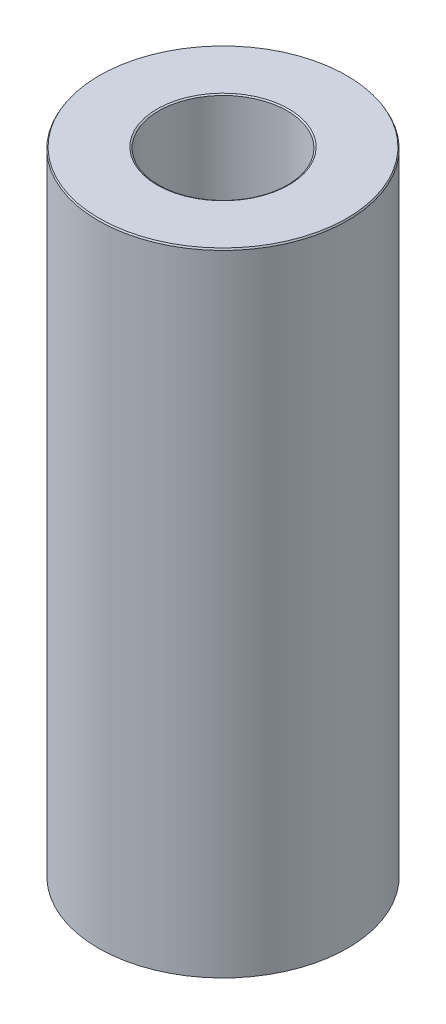
from build123d import *
from OCP.BRepFilletAPI import BRepFilletAPI_MakeChamfer

# Parameters (mm, degrees)
SKETCH1_R           = 35
BOSS_EXTRUDE1_DEPTH = 177.647973818
SKETCH2_R           = 18.075772868
CUT_EXTRUDE1_DEPTH  = 185.414757006
CHAMFER1_SIZE       = 0.430090085
CHAMFER1_SIZE2      = 0.248312626


with BuildPart() as part:
    # Sketch1 → Boss-Extrude1 (new body)
    with BuildSketch(Plane(origin=(0, 0, 0), x_dir=(1, 0, 0), z_dir=(0, 1, 0))):
        Circle(SKETCH1_R)
    extrude(amount=BOSS_EXTRUDE1_DEPTH)

    # Sketch2 → Cut-Extrude1 (cut, through all)
    with BuildSketch(Plane(origin=(0, 0, 0), x_dir=(1, 0, 0), z_dir=(0, 1, 0))):
        Circle(SKETCH2_R)
    extrude(amount=CUT_EXTRUDE1_DEPTH, mode=Mode.SUBTRACT)

    # Chamfer1: one chamfer whose edges measure the first distance from different faces: ONE call of the kernel's chamfer builder (chamfer() names one face for all edges)
    chamfer1_edges_1 = [part.edges().sort_by_distance(p)[0] for p in [
        (-18.075772868, 177.647973818, 0),
    ]]
    chamfer1_side_1 = [part.faces().sort_by_distance(p)[0] for p in [
        (-34.010050506, 177.647973818, 0),
    ]]
    chamfer1_edges_2 = [part.edges().sort_by_distance(p)[0] for p in [
        (-18.075772868, 0, 0),
    ]]
    chamfer1_side_2 = [part.faces().sort_by_distance(p)[0] for p in [
        (-18.075772868, 88.823986909, 0),
    ]]
    chamfer1_edges_3 = [part.edges().sort_by_distance(p)[0] for p in [
        (-35, 0, 0),
    ]]
    chamfer1_side_3 = [part.faces().sort_by_distance(p)[0] for p in [
        (-34.010050506, 0, 0),
    ]]
    chamfer1_edges_4 = [part.edges().sort_by_distance(p)[0] for p in [
        (-35, 177.647973818, 0),
    ]]
    chamfer1_side_4 = [part.faces().sort_by_distance(p)[0] for p in [
        (-35, 88.823986909, 0),
    ]]
    chamfer1 = BRepFilletAPI_MakeChamfer(part.part.solid().wrapped)
    for e in chamfer1_edges_1:
        chamfer1.Add(CHAMFER1_SIZE, CHAMFER1_SIZE2, e.wrapped, chamfer1_side_1[0].wrapped)  # the first distance lies on this face
    for e in chamfer1_edges_2:
        chamfer1.Add(CHAMFER1_SIZE, CHAMFER1_SIZE2, e.wrapped, chamfer1_side_2[0].wrapped)  # the first distance lies on this face
    for e in chamfer1_edges_3:
        chamfer1.Add(CHAMFER1_SIZE, CHAMFER1_SIZE2, e.wrapped, chamfer1_side_3[0].wrapped)  # the first distance lies on this face
    for e in chamfer1_edges_4:
        chamfer1.Add(CHAMFER1_SIZE, CHAMFER1_SIZE2, e.wrapped, chamfer1_side_4[0].wrapped)  # the first distance lies on this face
    add(Compound.cast(chamfer1.Shape()), mode=Mode.REPLACE)


solid = part.part
